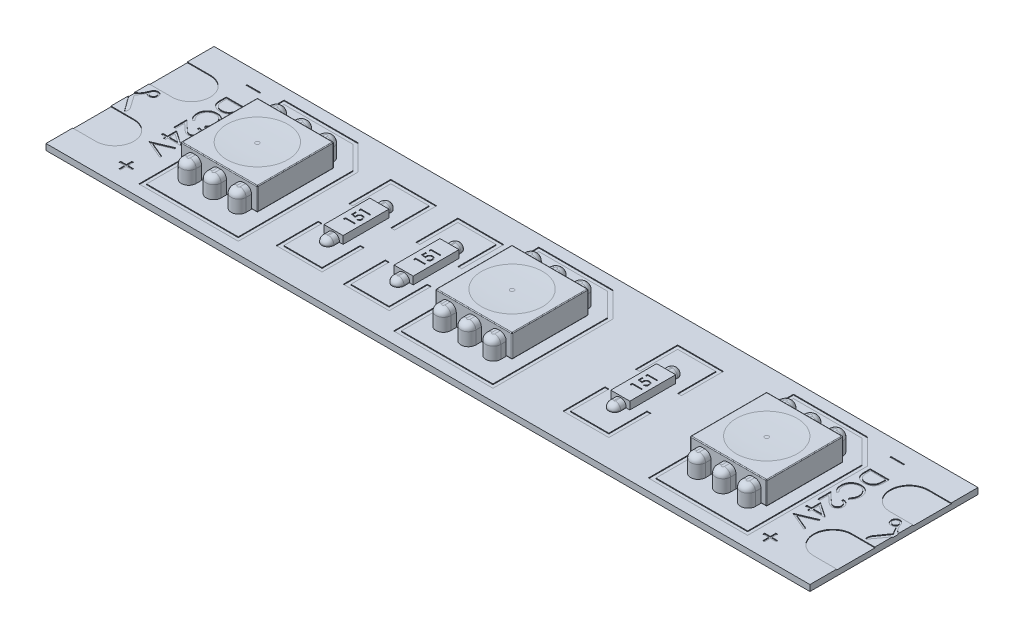
from build123d import *

# Parameters (mm, degrees)
SKETCH1_W               = 50
SKETCH1_H               = 11
BOSS_EXTRUDE1_DEPTH     = 0.4
CUT_EXTRUDE1_DEPTH      = 0.05
SKETCH3_W               = 5
SKETCH3_H               = 5
BOSS_EXTRUDE2_DEPTH     = 1.5
BOSS_EXTRUDE2_2_DEPTH   = 1.5
BOSS_EXTRUDE2_3_DEPTH   = 1.5
SKETCH4_R               = 2
CUT_EXTRUDE2_DEPTH      = 0.05
CUT_EXTRUDE_THIN1_DEPTH = 0.05
LPATTERN1_COUNT         = 3
LPATTERN1_PITCH         = 16.67
CUT_EXTRUDE_THIN2_START = -0.05
CUT_EXTRUDE_THIN2_DEPTH = 1.05
LPATTERN2_COUNT         = 2
LPATTERN2_PITCH         = 14.38
LPATTERN3_COUNT         = 2
LPATTERN3_PITCH         = 18.77
SKETCH8_W               = 1.25
SKETCH8_H               = 3
BOSS_EXTRUDE3_DEPTH     = 0.5
BOSS_EXTRUDE4_DEPTH     = 0.4
BOSS_EXTRUDE4_2_DEPTH   = 0.4
FILLET4_R               = 0.35
FILLET5_R               = 0.35
LPATTERN4_COUNT         = 2
LPATTERN4_PITCH         = 18.77
LPATTERN5_COUNT         = 2
LPATTERN5_PITCH         = 4.59
FILLET6_R               = 0.05
FILLET7_R               = 0.05
FILLET8_R               = 0.05
SKETCH10_W              = 0.897435897
SKETCH10_H              = 0.080128205
CUT_EXTRUDE3_DEPTH      = 0.05
LPATTERN6_COUNT         = 2
LPATTERN6_PITCH         = 42.15
CUT_EXTRUDE4_DEPTH      = 0.05
LPATTERN7_COUNT         = 2
LPATTERN7_PITCH         = 4.59
LPATTERN8_COUNT         = 2
LPATTERN8_PITCH         = 18.77
BOSS_EXTRUDE5_DEPTH     = 1.25
BOSS_EXTRUDE5_2_DEPTH   = 1.25
BOSS_EXTRUDE5_3_DEPTH   = 1.25
BOSS_EXTRUDE5_4_DEPTH   = 1.25
BOSS_EXTRUDE5_5_DEPTH   = 1.25
BOSS_EXTRUDE5_6_DEPTH   = 1.25
FILLET9_R               = 0.4
FILLET10_R              = 0.4
FILLET11_R              = 0.4
FILLET12_R              = 0.4
FILLET13_R              = 0.4
FILLET14_R              = 0.4
LPATTERN9_COUNT         = 3
LPATTERN9_PITCH         = 16.67
FILLET18_R              = 35
FILLET19_R              = 35
FILLET20_R              = 35
CUT_EXTRUDE5_DEPTH      = 0.05


with BuildPart() as part:
    # Sketch1 → Boss-Extrude1 (new body)
    with BuildSketch(Plane(origin=(0, 0, 0), x_dir=(1, 0, 0), z_dir=(0, 1, 0))):
        Rectangle(SKETCH1_W, SKETCH1_H)
    extrude(amount=BOSS_EXTRUDE1_DEPTH)

    # Sketch2 → Cut-Extrude1 (cut)
    with BuildSketch(Plane(origin=(0, 0.4, 0), x_dir=(1, 0, 0), z_dir=(0, 1, 0))):
        with BuildLine():
            Line((-26.5, 3.75), (-23.5, 3.75))
            ThreePointArc((-23.5, 3.75), (-22.25, 2.5), (-23.5, 1.25))
            Line((-23.5, 1.25), (-26.5, 1.25))
            ThreePointArc((-26.5, 1.25), (-27.75, 2.5), (-26.5, 3.75))
        make_face()
        with BuildLine():
            Line((-26.5, -3.75), (-23.5, -3.75))
            ThreePointArc((-23.5, -3.75), (-22.25, -2.5), (-23.5, -1.25))
            Line((-23.5, -1.25), (-26.5, -1.25))
            ThreePointArc((-26.5, -1.25), (-27.75, -2.5), (-26.5, -3.75))
        make_face()
        with BuildLine():
            Line((26.5, -3.75), (23.5, -3.75))
            ThreePointArc((23.5, -3.75), (22.25, -2.5), (23.5, -1.25))
            Line((23.5, -1.25), (26.5, -1.25))
            ThreePointArc((26.5, -1.25), (27.75, -2.5), (26.5, -3.75))
        make_face()
        with BuildLine():
            Line((26.5, 3.75), (23.5, 3.75))
            ThreePointArc((23.5, 3.75), (22.25, 2.5), (23.5, 1.25))
            Line((23.5, 1.25), (26.5, 1.25))
            ThreePointArc((26.5, 1.25), (27.75, 2.5), (26.5, 3.75))
        make_face()
    extrude(amount=-CUT_EXTRUDE1_DEPTH, mode=Mode.SUBTRACT)

    # Sketch5 → Cut-Extrude-Thin1 (cut)
    with BuildSketch(Plane(origin=(0, 0.4, 0), x_dir=(1, 0, 0), z_dir=(0, 1, 0))):
        Polygon((-13.166666667, 3.103553391), (-13.166666667, -4.75), (-19.666666667, -4.75), (-19.666666667, 4.75), (-14.813113276, 4.75), align=None)
        Polygon((-13.416666667, 3), (-13.416666667, -4.5), (-19.416666667, -4.5), (-19.416666667, 4.5), (-14.916666667, 4.5), align=None, mode=Mode.SUBTRACT)
    cut_extrude_thin1 = extrude(amount=-CUT_EXTRUDE_THIN1_DEPTH, mode=Mode.SUBTRACT)

    # LPattern1: Cut-Extrude-Thin1 ×3
    with Locations(*[(i * LPATTERN1_PITCH, 0, 0) for i in range(1, LPATTERN1_COUNT)]):
        add(cut_extrude_thin1, mode=Mode.SUBTRACT)

    # Cut-Extrude-Thin2: read off the stored shape, not the designer's step
    # Cut-Extrude-Thin2 outline → Cut-Extrude-Thin2 (cut)
    with BuildSketch(Plane(origin=(0, 0.4, 0), x_dir=(1, 0, 0), z_dir=(0, 1, 0)).offset(CUT_EXTRUDE_THIN2_START)):
        Polygon((10.088333333, 3.75), (7.088333333, 3.75), (7.088333333, 1), (7.338333333, 1), (7.338333333, 3.5), (9.838333333, 3.5), (9.838333333, 1), (10.088333333, 1), align=None)
        Polygon((7.088333333, -3.75), (10.088333333, -3.75), (10.088333333, -1), (9.838333333, -1), (9.838333333, -3.5), (7.338333333, -3.5), (7.338333333, -1), (7.088333333, -1), align=None)
    cut_extrude_thin2 = extrude(amount=CUT_EXTRUDE_THIN2_DEPTH, mode=Mode.SUBTRACT)

    # LPattern2: Cut-Extrude-Thin2 ×2
    with Locations(*[(-i * LPATTERN2_PITCH, 0, 0) for i in range(1, LPATTERN2_COUNT)]):
        add(cut_extrude_thin2, mode=Mode.SUBTRACT)

    # LPattern3: Cut-Extrude-Thin2 ×2
    with Locations(*[(-i * LPATTERN3_PITCH, 0, 0) for i in range(1, LPATTERN3_COUNT)]):
        add(cut_extrude_thin2, mode=Mode.SUBTRACT)

    # Sketch10 → Cut-Extrude3 (cut)
    # profile 1 of 7: a face of its own
    with BuildSketch(Plane(origin=(0, 0.4, 0), x_dir=(1, 0, 0), z_dir=(0, 1, 0))):
        with Locations((-21.303407586, 4.370192307)):
            Rectangle(SKETCH10_W, SKETCH10_H)
    # profile 2 of 7: a face of its own
    with BuildSketch(Plane(origin=(0, 0.4, 0), x_dir=(1, 0, 0), z_dir=(0, 1, 0))):
        with BuildLine():
            Line((-21.736099893, 3.032051282), (-20.486099893, 3.032051282))
            Line((-20.486099893, 3.032051282), (-20.486099893, 2.779647436))
            add(Edge.make_bspline(
                [(-20.486099893, 2.779647436), (-20.486257523, 2.75769418), (-20.486562063, 2.715280604), (-20.488504044, 2.653991056), (-20.491904722, 2.597363452), (-20.496953762, 2.54542995), (-20.503014025, 2.498107115), (-20.510721167, 2.455470741), (-20.519785287, 2.417451731), (-20.527516169, 2.394069834), (-20.531172008, 2.383012821)],
                knots=[0, 0, 0, 0, 1.314317071, 2.539253741, 3.67075822, 4.709970291, 5.662644612, 6.526156501, 7.303037452, 8, 8, 8, 8], degree=3))
            add(Edge.make_bspline(
                [(-20.531172008, 2.383012821), (-20.536682981, 2.368550423), (-20.547579955, 2.339953587), (-20.568135687, 2.299236624), (-20.591426415, 2.260906633), (-20.617480848, 2.22475511), (-20.647044145, 2.191618781), (-20.678832934, 2.160161717), (-20.714146193, 2.131796052), (-20.751784931, 2.105383456), (-20.792130975, 2.082272002), (-20.834365486, 2.061890384), (-20.878409438, 2.044488041), (-20.924583405, 2.03090942), (-20.97244412, 2.019691167), (-21.022353889, 2.012163987), (-21.074021749, 2.007163985), (-21.109084509, 2.006663964), (-21.126875133, 2.006410256)],
                knots=[0, 0, 0, 0, 0.98467389, 1.947018643, 2.898343565, 3.837828625, 4.779009928, 5.722093987, 6.681368302, 7.658573986, 8.646467994, 9.637429229, 10.641859304, 11.657149908, 12.698561448, 13.768651538, 14.867827761, 16, 16, 16, 16], degree=3))
            add(Edge.make_bspline(
                [(-21.126875133, 2.006410256), (-21.142325523, 2.006635039), (-21.172772131, 2.007077997), (-21.217644627, 2.011050586), (-21.261182455, 2.01683576), (-21.303194402, 2.025751403), (-21.343963479, 2.036706578), (-21.383296079, 2.050228642), (-21.421221032, 2.066253597), (-21.457429412, 2.084845764), (-21.49186132, 2.105175472), (-21.523924244, 2.127465808), (-21.554227977, 2.150437677), (-21.581405663, 2.175862357), (-21.607011684, 2.201987804), (-21.6296625, 2.230199402), (-21.650344762, 2.259578032), (-21.668907506, 2.290689574), (-21.685012742, 2.324279724), (-21.698809812, 2.360806942), (-21.710170314, 2.400466858), (-21.719663804, 2.443198683), (-21.727190272, 2.489086147), (-21.732235746, 2.538171344), (-21.735647412, 2.590379704), (-21.735946137, 2.626229435), (-21.736099893, 2.64468149)],
                knots=[0, 0, 0, 0, 1.105818345, 2.179130549, 3.222742436, 4.24813173, 5.251184997, 6.243232575, 7.223185975, 8.195898781, 9.155064964, 10.083206407, 10.990357329, 11.874224667, 12.744762365, 13.607037788, 14.46074101, 15.315384698, 16.197310979, 17.123950979, 18.107232398, 19.148086642, 20.256146639, 21.433991621, 22.679261309, 24, 24, 24, 24], degree=3))
            Line((-21.736099893, 2.64468149), (-21.736099893, 3.032051282))
        make_face()
        with BuildLine():
            Line((-21.607894765, 2.919871795), (-21.607894765, 2.776392228))
            add(Edge.make_bspline(
                [(-21.607894765, 2.776392228), (-21.607806159, 2.755774952), (-21.607635737, 2.716120381), (-21.606140308, 2.659099668), (-21.603696759, 2.606999884), (-21.600277088, 2.55981363), (-21.595752583, 2.51756755), (-21.590707974, 2.480173354), (-21.584423171, 2.447753619), (-21.578726399, 2.428135963), (-21.576093883, 2.419070513)],
                knots=[0, 0, 0, 0, 1.375205317, 2.645023457, 3.804390687, 4.853969522, 5.800190428, 6.637939096, 7.370582563, 8, 8, 8, 8], degree=3))
            add(Edge.make_bspline(
                [(-21.576093883, 2.419070513), (-21.572075769, 2.407660142), (-21.564135513, 2.385111938), (-21.549646304, 2.352657896), (-21.532504399, 2.322374665), (-21.513337546, 2.293757016), (-21.491848906, 2.266990259), (-21.467973439, 2.242193136), (-21.441975189, 2.219189406), (-21.413756764, 2.198230706), (-21.383500604, 2.179503004), (-21.351591895, 2.163179737), (-21.318107648, 2.149329685), (-21.282927177, 2.138067592), (-21.246083643, 2.129340118), (-21.207673975, 2.123130622), (-21.16768619, 2.119270374), (-21.140489127, 2.118819558), (-21.126624733, 2.118589744)],
                knots=[0, 0, 0, 0, 0.998463025, 1.973077781, 2.929496817, 3.867873318, 4.813809365, 5.759268434, 6.706333209, 7.676553387, 8.657505312, 9.640584699, 10.632319813, 11.645628493, 12.686877747, 13.755137172, 14.855624085, 16, 16, 16, 16], degree=3))
            add(Edge.make_bspline(
                [(-21.126624733, 2.118589744), (-21.11200572, 2.118773256), (-21.083286541, 2.119133767), (-21.041145766, 2.123657537), (-21.000621458, 2.130282414), (-20.961684442, 2.139811784), (-20.924385375, 2.152122907), (-20.888513534, 2.166854165), (-20.854530556, 2.184740223), (-20.822148616, 2.204989133), (-20.79185812, 2.227722242), (-20.764013936, 2.252838708), (-20.738564198, 2.280073693), (-20.715468385, 2.309301679), (-20.695137225, 2.340931322), (-20.677050942, 2.374427388), (-20.661683761, 2.410261713), (-20.653513338, 2.435195288), (-20.649361111, 2.447866587)],
                knots=[0, 0, 0, 0, 1.122272916, 2.204715076, 3.251197285, 4.274229216, 5.279697671, 6.265416158, 7.248880903, 8.225321784, 9.195852973, 10.153576302, 11.101466393, 12.055578741, 13.010401466, 13.985536859, 14.976245305, 16, 16, 16, 16], degree=3))
            add(Edge.make_bspline(
                [(-20.649361111, 2.447866587), (-20.646462387, 2.458349139), (-20.640298904, 2.480637921), (-20.633575556, 2.517009158), (-20.627645378, 2.55794314), (-20.62262465, 2.603621605), (-20.619022035, 2.653992483), (-20.616317994, 2.709094515), (-20.614494197, 2.768951516), (-20.614369658, 2.810445278), (-20.614305021, 2.83198117)],
                knots=[0, 0, 0, 0, 0.674548936, 1.434276114, 2.292660221, 3.240891867, 4.284742987, 5.42552168, 6.663806718, 8, 8, 8, 8], degree=3))
            Line((-20.614305021, 2.83198117), (-20.614305021, 2.919871795))
            Line((-20.614305021, 2.919871795), (-21.607894765, 2.919871795))
        make_face(mode=Mode.SUBTRACT)
    # profile 3 of 7: a face of its own
    with BuildSketch(Plane(origin=(0, 0.4, 0), x_dir=(1, 0, 0), z_dir=(0, 1, 0))):
        with BuildLine():
            Line((-20.71546688, 0.596153846), (-20.790587072, 0.694310897))
            add(Edge.make_bspline(
                [(-20.790587072, 0.694310897), (-20.782242083, 0.701313), (-20.765664613, 0.715222803), (-20.742386205, 0.737601089), (-20.720577183, 0.760923105), (-20.700133654, 0.785179934), (-20.681770524, 0.810808191), (-20.664530844, 0.837187047), (-20.64907808, 0.864757778), (-20.6303413, 0.902883397), (-20.610789101, 0.952757629), (-20.59439509, 1.0155415), (-20.583958956, 1.081081178), (-20.582828656, 1.125794606), (-20.582253739, 1.14853766)],
                knots=[0, 0, 0, 0, 0.757959112, 1.505699292, 2.245454638, 2.979532153, 3.711538275, 4.438200793, 5.171680507, 5.909471876, 7.393775596, 8.890124382, 10.418191784, 12, 12, 12, 12], degree=3))
            add(Edge.make_bspline(
                [(-20.582253739, 1.14853766), (-20.582398662, 1.161067258), (-20.582687164, 1.186010166), (-20.58646653, 1.223029726), (-20.59183965, 1.25942813), (-20.599618357, 1.295070027), (-20.609745528, 1.329884648), (-20.621621996, 1.364137076), (-20.636401055, 1.397423911), (-20.652722553, 1.43014575), (-20.671162846, 1.46149402), (-20.691270083, 1.491161155), (-20.712846915, 1.519011619), (-20.735837645, 1.545122585), (-20.760528002, 1.569207692), (-20.786627533, 1.591652938), (-20.814450378, 1.612053808), (-20.843474744, 1.630911617), (-20.87374329, 1.647691694), (-20.905065602, 1.662182103), (-20.937321923, 1.674601589), (-20.970578333, 1.684519929), (-21.00470396, 1.692343143), (-21.039771226, 1.697747774), (-21.075712063, 1.701493142), (-21.1000725, 1.701778989), (-21.112351896, 1.701923077)],
                knots=[0, 0, 0, 0, 1.055000685, 2.100209969, 3.131349012, 4.153242145, 5.170189196, 6.184191144, 7.204341339, 8.235672124, 9.263040994, 10.265373269, 11.252624173, 12.22887325, 13.193405896, 14.155809299, 15.126090485, 16.097288279, 17.069732292, 18.038585918, 19.002221264, 19.978698174, 20.959418239, 21.948869816, 22.966084182, 24, 24, 24, 24], degree=3))
            add(Edge.make_bspline(
                [(-21.112351896, 1.701923077), (-21.130827368, 1.701472427), (-21.167101505, 1.700587636), (-21.220233866, 1.692713231), (-21.271134107, 1.680747127), (-21.31948405, 1.662812993), (-21.365879892, 1.640699046), (-21.409536626, 1.612755971), (-21.45111397, 1.580392922), (-21.489629309, 1.543152057), (-21.524812782, 1.502292837), (-21.555795133, 1.458454298), (-21.581621876, 1.411745623), (-21.603113286, 1.362682541), (-21.619633546, 1.310887501), (-21.63126359, 1.256453642), (-21.638850083, 1.199499358), (-21.6395764, 1.160581716), (-21.639946047, 1.14077524)],
                knots=[0, 0, 0, 0, 1.029171465, 2.020641659, 2.987623507, 3.938342917, 4.889210282, 5.84687017, 6.821220943, 7.821438502, 8.827599549, 9.822697543, 10.807740252, 11.797342354, 12.80366471, 13.83203677, 14.896651826, 16, 16, 16, 16], degree=3))
            add(Edge.make_bspline(
                [(-21.639946047, 1.14077524), (-21.639342911, 1.118952851), (-21.638155796, 1.07600117), (-21.628098921, 1.013012589), (-21.611792522, 0.952714101), (-21.588971836, 0.895102463), (-21.559305661, 0.840340089), (-21.523342134, 0.788341282), (-21.480739158, 0.73906215), (-21.448209469, 0.709429549), (-21.431612713, 0.694310897)],
                knots=[0, 0, 0, 0, 1.028121516, 2.023589091, 2.998037872, 3.967518031, 4.937445131, 5.927275754, 6.942489185, 8, 8, 8, 8], degree=3))
            Line((-21.431612713, 0.694310897), (-21.505981704, 0.596153846))
            add(Edge.make_bspline(
                [(-21.505981704, 0.596153846), (-21.516174026, 0.604053161), (-21.536509848, 0.619813952), (-21.565178058, 0.645334828), (-21.59214475, 0.672218996), (-21.617186737, 0.700669626), (-21.640826798, 0.730346447), (-21.662272417, 0.761772202), (-21.682176863, 0.794404107), (-21.700161304, 0.82843215), (-21.716286329, 0.863744612), (-21.729899521, 0.900304744), (-21.741794911, 0.937802807), (-21.751516418, 0.976257686), (-21.759116317, 1.015797846), (-21.764193926, 1.056287625), (-21.76767341, 1.097812493), (-21.767990491, 1.125827299), (-21.768151175, 1.140024038)],
                knots=[0, 0, 0, 0, 0.986756325, 1.968786143, 2.935506311, 3.899499537, 4.868307269, 5.8376204, 6.809456583, 7.792545619, 8.781780509, 9.778496008, 10.776623214, 11.79151764, 12.812666265, 13.856269958, 14.913646641, 16, 16, 16, 16], degree=3))
            add(Edge.make_bspline(
                [(-21.768151175, 1.140024038), (-21.768057606, 1.153468205), (-21.767872586, 1.18005238), (-21.764875383, 1.219301934), (-21.760786191, 1.257512499), (-21.754629002, 1.294574865), (-21.747363166, 1.330691285), (-21.737623431, 1.365534351), (-21.726713015, 1.399446926), (-21.713889805, 1.432292762), (-21.69941974, 1.464099798), (-21.683065612, 1.494765445), (-21.664964946, 1.524275599), (-21.645516728, 1.552920392), (-21.624096263, 1.580276672), (-21.601001036, 1.606581503), (-21.57630889, 1.631982387), (-21.558503585, 1.647697632), (-21.549551415, 1.655598958)],
                knots=[0, 0, 0, 0, 1.114604814, 2.203992996, 3.262667896, 4.300477797, 5.318619304, 6.316056647, 7.298880507, 8.271930387, 9.238335007, 10.195173496, 11.151986948, 12.108099108, 13.064862484, 14.031167946, 15.010108607, 16, 16, 16, 16], degree=3))
            add(Edge.make_bspline(
                [(-21.549551415, 1.655598958), (-21.534000991, 1.668254545), (-21.50308788, 1.69341293), (-21.452985744, 1.725600674), (-21.400675669, 1.753153372), (-21.345882837, 1.775430487), (-21.288730199, 1.792845749), (-21.229188944, 1.804910461), (-21.167314679, 1.81275032), (-21.125230112, 1.813646852), (-21.103838274, 1.814102564)],
                knots=[0, 0, 0, 0, 0.994628077, 1.977248131, 2.950237994, 3.925870899, 4.908910175, 5.911660606, 6.938484602, 8, 8, 8, 8], degree=3))
            add(Edge.make_bspline(
                [(-21.103838274, 1.814102564), (-21.081355125, 1.813544654), (-21.037120931, 1.812446999), (-20.972188236, 1.803198244), (-20.91006764, 1.788139483), (-20.850520119, 1.76740347), (-20.793886381, 1.740047123), (-20.739927237, 1.706930054), (-20.688686747, 1.667728787), (-20.640820025, 1.622935654), (-20.597057136, 1.573801874), (-20.558554616, 1.521188689), (-20.526512726, 1.465194958), (-20.499728361, 1.40643863), (-20.479141058, 1.344479445), (-20.464729204, 1.279449674), (-20.455758806, 1.211471489), (-20.454624803, 1.165092052), (-20.454048611, 1.141526442)],
                knots=[0, 0, 0, 0, 1.032901378, 2.032168977, 3.007206631, 3.966850309, 4.924221947, 5.891988639, 6.871730993, 7.884084801, 8.900290346, 9.89161143, 10.874607481, 11.860025555, 12.854717796, 13.869097222, 14.917278314, 16, 16, 16, 16], degree=3))
            add(Edge.make_bspline(
                [(-20.454048611, 1.141526442), (-20.454220674, 1.127164103), (-20.454561257, 1.098735298), (-20.457886744, 1.056681187), (-20.463420461, 1.015735999), (-20.471002026, 0.975800714), (-20.480294484, 0.936730518), (-20.492459029, 0.898926242), (-20.506585048, 0.862182028), (-20.522439479, 0.826470357), (-20.540564725, 0.792179759), (-20.560250643, 0.759316477), (-20.581951649, 0.728276945), (-20.604950307, 0.698477307), (-20.630106918, 0.670588449), (-20.656602237, 0.64381387), (-20.685222473, 0.619078466), (-20.705366956, 0.603809374), (-20.71546688, 0.596153846)],
                knots=[0, 0, 0, 0, 1.096705196, 2.170817488, 3.219277236, 4.250701065, 5.274195539, 6.284202015, 7.28098643, 8.279664616, 9.266225751, 10.241373748, 11.203306326, 12.157093976, 13.114198862, 14.069774147, 15.032234603, 16, 16, 16, 16], degree=3))
        make_face()
    # profile 4 of 7: a face of its own
    with BuildSketch(Plane(origin=(0, 0.4, 0), x_dir=(1, 0, 0), z_dir=(0, 1, 0))):
        with BuildLine():
            Line((-20.870715278, 0.291666667), (-20.870715278, 0.403846154))
            add(Edge.make_bspline(
                [(-20.870715278, 0.403846154), (-20.855832744, 0.403115152), (-20.826603845, 0.401679484), (-20.783989202, 0.394953335), (-20.743251589, 0.385337966), (-20.704740254, 0.371710745), (-20.667995149, 0.354882319), (-20.633504206, 0.334279454), (-20.600925105, 0.310341372), (-20.570874678, 0.283111988), (-20.543404831, 0.253565596), (-20.519432183, 0.221879226), (-20.499409379, 0.188378553), (-20.48257975, 0.153354149), (-20.469962409, 0.116400945), (-20.460596437, 0.077872173), (-20.454962328, 0.037593686), (-20.454356649, 0.010150852), (-20.454048611, -0.00380609)],
                knots=[0, 0, 0, 0, 1.100776268, 2.161895295, 3.184016182, 4.190939212, 5.176500551, 6.166955529, 7.155448256, 8.160289653, 9.16017456, 10.133824356, 11.091467644, 12.04088621, 13.000931625, 13.972173743, 14.968683325, 16, 16, 16, 16], degree=3))
            add(Edge.make_bspline(
                [(-20.454048611, -0.00380609), (-20.454369488, -0.017512545), (-20.455000001, -0.044445239), (-20.460414654, -0.083753102), (-20.468895222, -0.121173564), (-20.480793585, -0.156633481), (-20.496788024, -0.189849932), (-20.51600143, -0.221072448), (-20.538222799, -0.250672738), (-20.564384875, -0.277318017), (-20.592314298, -0.301785189), (-20.622131406, -0.322893137), (-20.65292758, -0.340969267), (-20.684937652, -0.356036295), (-20.718463019, -0.367127773), (-20.753015592, -0.375548562), (-20.788953024, -0.380308353), (-20.813276794, -0.381038861), (-20.825643162, -0.381410256)],
                knots=[0, 0, 0, 0, 1.111607364, 2.184268762, 3.212621178, 4.221274766, 5.211760367, 6.196651075, 7.1921475, 8.207485113, 9.220403448, 10.201281604, 11.166441695, 12.114753415, 13.065576456, 14.026450734, 14.996634279, 16, 16, 16, 16], degree=3))
            add(Edge.make_bspline(
                [(-20.825643162, -0.381410256), (-20.843053103, -0.38080552), (-20.877567465, -0.379606658), (-20.928287059, -0.369351524), (-20.977427566, -0.353334913), (-21.016976602, -0.334050143), (-21.048845707, -0.314595698), (-21.07508453, -0.297064446), (-21.103336483, -0.276541299), (-21.133506961, -0.252727549), (-21.165832284, -0.226115809), (-21.200292925, -0.196465037), (-21.236532843, -0.163563793), (-21.261284844, -0.140471472), (-21.27411071, -0.128505609)],
                knots=[0, 0, 0, 0, 1.184426356, 2.348067706, 3.509069118, 4.696110526, 5.333549288, 6.050745305, 6.844228056, 7.710549037, 8.667450064, 9.695053472, 10.805634456, 12, 12, 12, 12], degree=3))
            Line((-21.27411071, -0.128505609), (-21.607894765, 0.184244792))
            Line((-21.607894765, 0.184244792), (-21.607894765, -0.397435897))
            Line((-21.607894765, -0.397435897), (-21.736099893, -0.397435897))
            Line((-21.736099893, -0.397435897), (-21.736099893, 0.451923077))
            Line((-21.736099893, 0.451923077), (-21.218772169, -0.032852564))
            add(Edge.make_bspline(
                [(-21.218772169, -0.032852564), (-21.206452017, -0.044656216), (-21.182787527, -0.067328617), (-21.148227628, -0.099382829), (-21.11620358, -0.128218975), (-21.086573475, -0.153856184), (-21.059505289, -0.17631555), (-21.034786894, -0.195525212), (-21.012630417, -0.211570075), (-20.986601915, -0.228574286), (-20.95478494, -0.244788929), (-20.916098513, -0.259039942), (-20.876185801, -0.267667311), (-20.84922214, -0.26870753), (-20.835659188, -0.269230769)],
                knots=[0, 0, 0, 0, 1.329530082, 2.553755191, 3.672934919, 4.687409497, 5.60679272, 6.413407421, 7.126401618, 7.737995624, 8.834647426, 9.90044882, 10.943907757, 12, 12, 12, 12], degree=3))
            add(Edge.make_bspline(
                [(-20.835659188, -0.269230769), (-20.827129174, -0.269006051), (-20.810318156, -0.268563174), (-20.785686765, -0.264580532), (-20.76183479, -0.258729241), (-20.739057143, -0.249710595), (-20.716905832, -0.238875023), (-20.696054325, -0.225031781), (-20.675791845, -0.209212591), (-20.656813176, -0.190863106), (-20.639425768, -0.170718781), (-20.624024639, -0.14943443), (-20.611153442, -0.126916716), (-20.600602216, -0.103259481), (-20.592325288, -0.078528969), (-20.586590083, -0.052677271), (-20.582989195, -0.025775838), (-20.582501991, -0.007406732), (-20.582253739, 0.001953125)],
                knots=[0, 0, 0, 0, 0.991504627, 1.954065223, 2.895985987, 3.842598665, 4.797835564, 5.759220273, 6.74786863, 7.784730864, 8.824135544, 9.839918996, 10.835834653, 11.835434876, 12.84861661, 13.863796685, 14.911511676, 16, 16, 16, 16], degree=3))
            add(Edge.make_bspline(
                [(-20.582253739, 0.001953125), (-20.582509031, 0.011728466), (-20.583010381, 0.030925621), (-20.586519571, 0.059110374), (-20.592567668, 0.086000393), (-20.600859482, 0.111650109), (-20.611298941, 0.136084236), (-20.62455262, 0.159081842), (-20.640103047, 0.180852886), (-20.657829685, 0.201357382), (-20.67765903, 0.220197797), (-20.699491447, 0.237099181), (-20.723468952, 0.251514274), (-20.749049967, 0.264292606), (-20.776914658, 0.27406992), (-20.806387801, 0.282427475), (-20.837888137, 0.28849862), (-20.859591156, 0.290593112), (-20.870715278, 0.291666667)],
                knots=[0, 0, 0, 0, 1.031212865, 2.025131798, 2.990757446, 3.934781266, 4.865570067, 5.788494791, 6.729227313, 7.684356718, 8.643577152, 9.610526866, 10.590658432, 11.59095419, 12.621640561, 13.700587263, 14.82141059, 16, 16, 16, 16], degree=3))
        make_face()
    # profile 5 of 7: a face of its own
    with BuildSketch(Plane(origin=(0, 0.4, 0), x_dir=(1, 0, 0), z_dir=(0, 1, 0))):
        Polygon((-20.454048611, -1.191957131), (-20.454048611, -1.21474359), (-21.319433226, -1.21474359), (-21.319433226, -1.358974359), (-21.447638355, -1.358974359), (-21.447638355, -1.21474359), (-21.736099893, -1.21474359), (-21.736099893, -1.102564103), (-21.447638355, -1.102564103), (-21.447638355, -0.509615385), align=None)
        Polygon((-21.319433226, -1.102564103), (-20.776564637, -1.102564103), (-21.319433226, -0.729967949), align=None, mode=Mode.SUBTRACT)
    # profile 6 of 7: a face of its own
    with BuildSketch(Plane(origin=(0, 0.4, 0), x_dir=(1, 0, 0), z_dir=(0, 1, 0))):
        Polygon((-20.486099893, -1.487179487), (-20.486099893, -1.607371795), (-21.471176015, -2.024038462), (-20.486099893, -2.440705128), (-20.486099893, -2.560897436), (-21.736099893, -2.032051282), (-21.736099893, -2.016025641), align=None)
    # profile 7 of 7: a face of its own
    with BuildSketch(Plane(origin=(0, 0.4, 0), x_dir=(1, 0, 0), z_dir=(0, 1, 0))):
        Polygon((-21.06302297, -4.067307692), (-20.694433226, -4.067307692), (-20.694433226, -4.179487179), (-21.06302297, -4.179487179), (-21.06302297, -4.548076923), (-21.175202457, -4.548076923), (-21.175202457, -4.179487179), (-21.543792201, -4.179487179), (-21.543792201, -4.067307692), (-21.175202457, -4.067307692), (-21.175202457, -3.698717949), (-21.06302297, -3.698717949), align=None)
    cut_extrude3 = extrude(amount=-CUT_EXTRUDE3_DEPTH, mode=Mode.SUBTRACT)

    # LPattern6: Cut-Extrude3 ×2
    with Locations(*[(i * LPATTERN6_PITCH, 0, 0) for i in range(1, LPATTERN6_COUNT)]):
        add(cut_extrude3, mode=Mode.SUBTRACT)

    # Sketch14 → Cut-Extrude5 (cut)
    # profile 1 of 2: a face of its own
    with BuildSketch(Plane(origin=(0, 0.4, 0), x_dir=(1, 0, 0), z_dir=(0, 1, 0))):
        with BuildLine():
            Line((-25.153037, 0.113892595), (-25.725001, -0.693609405))
            add(Edge.make_bspline(
                [(-25.725001, -0.693609405), (-25.796599, -0.810489405), (-25.839587, -0.965981405), (-25.746759, -1.114005405)],
                knots=[0.25, 0.25, 0.25, 0.25, 0.5, 0.5, 0.5, 0.5], degree=3))
            Line((-25.746759, -1.114005405), (-24.999009, -0.096671405))
            Line((-24.999009, -0.096671405), (-24.247501, -1.124021405))
            add(Edge.make_bspline(
                [(-24.268323, -0.703575405), (-24.196985, -0.820617405), (-24.154341, -0.976203405), (-24.247501, -1.124021405)],
                knots=[0.25, 0.25, 0.25, 0.25, 0.5, 0.5, 0.5, 0.5], degree=3))
            Line((-24.268323, -0.703575405), (-24.844459, 0.113672595))
            add(Edge.make_bspline(
                [(-24.844459, 0.113672595), (-24.632181, 0.406328595), (-24.574057, 0.636966595), (-24.502161, 0.616496595)],
                knots=[0, 0, 0, 0, 0.125, 0.125, 0.125, 0.125], degree=3))
            add(Edge.make_bspline(
                [(-24.502161, 0.616496595), (-24.445963, 0.600496595), (-24.472971, 0.552398595), (-24.324453, 0.518464595)],
                knots=[0.125, 0.125, 0.125, 0.125, 0.25, 0.25, 0.25, 0.25], degree=3))
            add(Edge.make_bspline(
                [(-24.324453, 0.518464595), (-24.181853, 0.485882595), (-24.036159, 0.602954595), (-24.005889, 0.744204595)],
                knots=[0.25, 0.25, 0.25, 0.25, 0.375, 0.375, 0.375, 0.375], degree=3))
            add(Edge.make_bspline(
                [(-24.005889, 0.744204595), (-23.965573, 0.882648595), (-24.030921, 1.056660595), (-24.177119, 1.099618595)],
                knots=[0.375, 0.375, 0.375, 0.375, 0.5, 0.5, 0.5, 0.5], degree=3))
            add(Edge.make_bspline(
                [(-24.177119, 1.099618595), (-24.321797, 1.151978595), (-24.494245, 1.066870595), (-24.545723, 0.922774595)],
                knots=[0.5, 0.5, 0.5, 0.5, 0.625, 0.625, 0.625, 0.625], degree=3))
            add(Edge.make_bspline(
                [(-24.545723, 0.922774595), (-24.620313, 0.758042595), (-24.658563, 0.540480595), (-24.899631, 0.353746595)],
                knots=[0.625, 0.625, 0.625, 0.625, 0.75, 0.75, 0.75, 0.75], degree=3))
            Line((-24.899631, 0.353746595), (-25.000991, 0.275296595))
            Line((-25.000991, 0.275296595), (-25.091357, 0.345616595))
            add(Edge.make_bspline(
                [(-25.443997, 0.915430595), (-25.369773, 0.750536595), (-25.332009, 0.532888595), (-25.091357, 0.345616595)],
                knots=[0.666666667, 0.666666667, 0.666666667, 0.666666667, 0.777777778, 0.777777778, 0.777777778, 0.777777778], degree=3))
            add(Edge.make_bspline(
                [(-25.812205, 1.093096595), (-25.667409, 1.145134595), (-25.495151, 1.059642595), (-25.443997, 0.915430595)],
                knots=[0.555555556, 0.555555556, 0.555555556, 0.555555556, 0.666666667, 0.666666667, 0.666666667, 0.666666667], degree=3))
            add(Edge.make_bspline(
                [(-25.984227, 0.738066595), (-26.024233, 0.876598595), (-25.958497, 1.050466595), (-25.812205, 1.093096595)],
                knots=[0.444444444, 0.444444444, 0.444444444, 0.444444444, 0.555555556, 0.555555556, 0.555555556, 0.555555556], degree=3))
            add(Edge.make_bspline(
                [(-25.666167, 0.511616595), (-25.808839, 0.479350595), (-25.954273, 0.596748595), (-25.984227, 0.738066595)],
                knots=[0.333333333, 0.333333333, 0.333333333, 0.333333333, 0.444444444, 0.444444444, 0.444444444, 0.444444444], degree=3))
            add(Edge.make_bspline(
                [(-25.488239, 0.609252595), (-25.544473, 0.593376595), (-25.517571, 0.545220595), (-25.666167, 0.511616595)],
                knots=[0.222222222, 0.222222222, 0.222222222, 0.222222222, 0.333333333, 0.333333333, 0.333333333, 0.333333333], degree=3))
            add(Edge.make_bspline(
                [(-25.159287, 0.122436595), (-25.370915, 0.415566595), (-25.416299, 0.629562595), (-25.488239, 0.609252595)],
                knots=[0.111111111, 0.111111111, 0.111111111, 0.111111111, 0.222222222, 0.222222222, 0.222222222, 0.222222222], degree=3))
            Line((-25.159287, 0.122436595), (-25.153037, 0.113892595))
        make_face()
        with BuildLine():
            add(Edge.make_bspline(
                [(-24.145233, 0.676072595), (-24.268559, 0.553042595), (-24.486723, 0.628072595), (-24.486351, 0.792302595)],
                knots=[0, 0, 0, 0, 0.25, 0.25, 0.25, 0.25], degree=3))
            add(Edge.make_bspline(
                [(-24.486351, 0.792302595), (-24.495083, 0.943398595), (-24.311435, 1.081008595), (-24.174925, 0.994760595)],
                knots=[0.25, 0.25, 0.25, 0.25, 0.5, 0.5, 0.5, 0.5], degree=3))
            add(Edge.make_bspline(
                [(-24.174925, 0.994760595), (-24.059985, 0.934288595), (-24.060809, 0.760294595), (-24.145233, 0.676072595)],
                knots=[0.5, 0.5, 0.5, 0.5, 1, 1, 1, 1], degree=3))
        make_face(mode=Mode.SUBTRACT)
        with BuildLine():
            add(Edge.make_bspline(
                [(-25.845033, 0.669622595), (-25.721981, 0.546318595), (-25.503651, 0.620862595), (-25.503659, 0.785092595)],
                knots=[0, 0, 0, 0, 0.25, 0.25, 0.25, 0.25], degree=3))
            add(Edge.make_bspline(
                [(-25.503659, 0.785092595), (-25.494587, 0.936168595), (-25.677929, 1.074188595), (-25.814631, 0.988244595)],
                knots=[0.25, 0.25, 0.25, 0.25, 0.5, 0.5, 0.5, 0.5], degree=3))
            add(Edge.make_bspline(
                [(-25.814631, 0.988244595), (-25.929705, 0.928028595), (-25.929269, 0.754032595), (-25.845033, 0.669622595)],
                knots=[0.5, 0.5, 0.5, 0.5, 1, 1, 1, 1], degree=3))
        make_face(mode=Mode.SUBTRACT)
    # profile 2 of 2: a face of its own
    with BuildSketch(Plane(origin=(0, 0.4, 0), x_dir=(1, 0, 0), z_dir=(0, 1, 0))):
        with BuildLine():
            Line((25.100369, 0.353746595), (24.999009, 0.275296595))
            Line((24.999009, 0.275296595), (24.908643, 0.345616595))
            add(Edge.make_bspline(
                [(24.556003, 0.915430595), (24.630227, 0.750536595), (24.667991, 0.532888595), (24.908643, 0.345616595)],
                knots=[0.666666667, 0.666666667, 0.666666667, 0.666666667, 0.777777778, 0.777777778, 0.777777778, 0.777777778], degree=3))
            add(Edge.make_bspline(
                [(24.187795, 1.093096595), (24.332591, 1.145134595), (24.504849, 1.059642595), (24.556003, 0.915430595)],
                knots=[0.555555556, 0.555555556, 0.555555556, 0.555555556, 0.666666667, 0.666666667, 0.666666667, 0.666666667], degree=3))
            add(Edge.make_bspline(
                [(24.015773, 0.738066595), (23.975767, 0.876598595), (24.041503, 1.050466595), (24.187795, 1.093096595)],
                knots=[0.444444444, 0.444444444, 0.444444444, 0.444444444, 0.555555556, 0.555555556, 0.555555556, 0.555555556], degree=3))
            add(Edge.make_bspline(
                [(24.333833, 0.511616595), (24.191161, 0.479350595), (24.045727, 0.596748595), (24.015773, 0.738066595)],
                knots=[0.333333333, 0.333333333, 0.333333333, 0.333333333, 0.444444444, 0.444444444, 0.444444444, 0.444444444], degree=3))
            add(Edge.make_bspline(
                [(24.511761, 0.609252595), (24.455527, 0.593376595), (24.482429, 0.545220595), (24.333833, 0.511616595)],
                knots=[0.222222222, 0.222222222, 0.222222222, 0.222222222, 0.333333333, 0.333333333, 0.333333333, 0.333333333], degree=3))
            add(Edge.make_bspline(
                [(24.840713, 0.122436595), (24.629085, 0.415566595), (24.583701, 0.629562595), (24.511761, 0.609252595)],
                knots=[0.111111111, 0.111111111, 0.111111111, 0.111111111, 0.222222222, 0.222222222, 0.222222222, 0.222222222], degree=3))
            Line((24.840713, 0.122436595), (24.846963, 0.113892595))
            Line((24.846963, 0.113892595), (24.274999, -0.693609405))
            add(Edge.make_bspline(
                [(24.274999, -0.693609405), (24.203401, -0.810489405), (24.160413, -0.965981405), (24.253241, -1.114005405)],
                knots=[0.25, 0.25, 0.25, 0.25, 0.5, 0.5, 0.5, 0.5], degree=3))
            Line((24.253241, -1.114005405), (25.000991, -0.096671405))
            Line((25.000991, -0.096671405), (25.752499, -1.124021405))
            add(Edge.make_bspline(
                [(25.731677, -0.703575405), (25.803015, -0.820617405), (25.845659, -0.976203405), (25.752499, -1.124021405)],
                knots=[0.25, 0.25, 0.25, 0.25, 0.5, 0.5, 0.5, 0.5], degree=3))
            Line((25.731677, -0.703575405), (25.155541, 0.113672595))
            add(Edge.make_bspline(
                [(25.155541, 0.113672595), (25.367819, 0.406328595), (25.425943, 0.636966595), (25.497839, 0.616496595)],
                knots=[0, 0, 0, 0, 0.125, 0.125, 0.125, 0.125], degree=3))
            add(Edge.make_bspline(
                [(25.497839, 0.616496595), (25.554037, 0.600496595), (25.527029, 0.552398595), (25.675547, 0.518464595)],
                knots=[0.125, 0.125, 0.125, 0.125, 0.25, 0.25, 0.25, 0.25], degree=3))
            add(Edge.make_bspline(
                [(25.675547, 0.518464595), (25.818147, 0.485882595), (25.963841, 0.602954595), (25.994111, 0.744204595)],
                knots=[0.25, 0.25, 0.25, 0.25, 0.375, 0.375, 0.375, 0.375], degree=3))
            add(Edge.make_bspline(
                [(25.994111, 0.744204595), (26.034427, 0.882648595), (25.969079, 1.056660595), (25.822881, 1.099618595)],
                knots=[0.375, 0.375, 0.375, 0.375, 0.5, 0.5, 0.5, 0.5], degree=3))
            add(Edge.make_bspline(
                [(25.822881, 1.099618595), (25.678203, 1.151978595), (25.505755, 1.066870595), (25.454277, 0.922774595)],
                knots=[0.5, 0.5, 0.5, 0.5, 0.625, 0.625, 0.625, 0.625], degree=3))
            add(Edge.make_bspline(
                [(25.454277, 0.922774595), (25.379687, 0.758042595), (25.341437, 0.540480595), (25.100369, 0.353746595)],
                knots=[0.625, 0.625, 0.625, 0.625, 0.75, 0.75, 0.75, 0.75], degree=3))
        make_face()
        with BuildLine():
            add(Edge.make_bspline(
                [(24.185369, 0.988244595), (24.070295, 0.928028595), (24.070731, 0.754032595), (24.154967, 0.669622595)],
                knots=[0.5, 0.5, 0.5, 0.5, 1, 1, 1, 1], degree=3))
            add(Edge.make_bspline(
                [(24.154967, 0.669622595), (24.278019, 0.546318595), (24.496349, 0.620862595), (24.496341, 0.785092595)],
                knots=[0, 0, 0, 0, 0.25, 0.25, 0.25, 0.25], degree=3))
            add(Edge.make_bspline(
                [(24.496341, 0.785092595), (24.505413, 0.936168595), (24.322071, 1.074188595), (24.185369, 0.988244595)],
                knots=[0.25, 0.25, 0.25, 0.25, 0.5, 0.5, 0.5, 0.5], degree=3))
        make_face(mode=Mode.SUBTRACT)
        with BuildLine():
            add(Edge.make_bspline(
                [(25.825075, 0.994760595), (25.940015, 0.934288595), (25.939191, 0.760294595), (25.854767, 0.676072595)],
                knots=[0.5, 0.5, 0.5, 0.5, 1, 1, 1, 1], degree=3))
            add(Edge.make_bspline(
                [(25.854767, 0.676072595), (25.731441, 0.553042595), (25.513277, 0.628072595), (25.513649, 0.792302595)],
                knots=[0, 0, 0, 0, 0.25, 0.25, 0.25, 0.25], degree=3))
            add(Edge.make_bspline(
                [(25.513649, 0.792302595), (25.504917, 0.943398595), (25.688565, 1.081008595), (25.825075, 0.994760595)],
                knots=[0.25, 0.25, 0.25, 0.25, 0.5, 0.5, 0.5, 0.5], degree=3))
        make_face(mode=Mode.SUBTRACT)
    extrude(amount=-CUT_EXTRUDE5_DEPTH, mode=Mode.SUBTRACT)


with BuildPart() as body_2:
    # Sketch3 → Boss-Extrude2 (new body)
    with BuildSketch(Plane(origin=(0, 0.4, 0), x_dir=(1, 0, 0), z_dir=(0, 1, 0))):
        Rectangle(SKETCH3_W, SKETCH3_H)
    extrude(amount=BOSS_EXTRUDE2_DEPTH)


with BuildPart() as body_3:
    # Sketch3 → Boss-Extrude2 2 (new body)
    with BuildSketch(Plane(origin=(0, 0.4, 0), x_dir=(1, 0, 0), z_dir=(0, 1, 0))):
        with Locations((16.666666667, 0)):
            Rectangle(SKETCH3_W, SKETCH3_H)
    extrude(amount=BOSS_EXTRUDE2_2_DEPTH)


with BuildPart() as body_4:
    # Sketch3 → Boss-Extrude2 3 (new body)
    with BuildSketch(Plane(origin=(0, 0.4, 0), x_dir=(1, 0, 0), z_dir=(0, 1, 0))):
        with Locations((-16.666666667, 0)):
            Rectangle(SKETCH3_W, SKETCH3_H)
    extrude(amount=BOSS_EXTRUDE2_3_DEPTH)


with BuildPart() as cut_extrude2_tool:
    # Sketch4 → Cut-Extrude2 (new body)
    with BuildSketch(Plane(origin=(0, 1.9, 0), x_dir=(1, 0, 0), z_dir=(0, 1, 0))):
        with Locations(Location((-16.666666667, 0, 0), (0, 0, 270))):
            Circle(SKETCH4_R)
        with Locations(Location((0.003333333, 0, 0), (0, 0, 270))):
            Circle(SKETCH4_R)
        with Locations(Location((16.673333333, 0, 0), (0, 0, 270))):
            Circle(SKETCH4_R)
    extrude(amount=-CUT_EXTRUDE2_DEPTH)


with BuildPart() as body_2_1:
    add(body_2.part)

    # Cut-Extrude2: cut by cut_extrude2_tool
    add(cut_extrude2_tool.part, mode=Mode.SUBTRACT)

    # Fillet7
    fillet7_edges = [body_2_1.edges().sort_by_distance(p)[0] for p in [
        (2.5, 1.9, 0),
        (0, 1.9, -2.5),
        (-2.5, 1.9, 0),
        (0, 0.4, -2.5),
        (2.5, 0.4, 0),
        (0, 0.4, 2.5),
        (-2.5, 0.4, 0),
        (0, 1.9, 2.5),
        (-2.5, 1.15, -2.5),
        (2.5, 1.15, -2.5),
        (2.5, 1.15, 2.5),
        (-2.5, 1.15, 2.5),
    ]]
    fillet(fillet7_edges, radius=FILLET7_R)

    # Fillet19
    # the kernel refuses this fillet: 35 mm, written as the material it adds along each edge
    with BuildSketch(Plane(origin=(0.003333333, 1.85, 0), x_dir=(0, 0, 1), z_dir=(-1, 0, 0))) as fillet19_piece_1:
        with BuildLine():
            CenterArc((0.129839579, 35), FILLET19_R, 270, 3.062952949)
            Line((0.129839579, 0), (2, 0))
            Line((2, 0), (2, 0.05))
        make_face()
    revolve(axis=Axis((0.003333333, 1.85, 0), (0, 1, 0)))


with BuildPart() as body_3_1:
    add(body_3.part)

    # Cut-Extrude2: cut by cut_extrude2_tool
    add(cut_extrude2_tool.part, mode=Mode.SUBTRACT)

    # Fillet8
    fillet8_edges = [body_3_1.edges().sort_by_distance(p)[0] for p in [
        (16.666666667, 1.9, 2.5),
        (19.166666667, 1.9, 0),
        (16.666666667, 1.9, -2.5),
        (19.166666667, 0.4, 0),
        (16.666666667, 0.4, 2.5),
        (14.166666667, 0.4, 0),
        (16.666666667, 0.4, -2.5),
        (14.166666667, 1.9, 0),
        (19.166666667, 1.15, -2.5),
        (19.166666667, 1.15, 2.5),
        (14.166666667, 1.15, 2.5),
        (14.166666667, 1.15, -2.5),
    ]]
    fillet(fillet8_edges, radius=FILLET8_R)

    # Fillet20
    # the kernel refuses this fillet: 35 mm, written as the material it adds along each edge
    with BuildSketch(Plane(origin=(16.673333333, 1.85, 0), x_dir=(0, 0, 1), z_dir=(-1, 0, 0))) as fillet20_piece_1:
        with BuildLine():
            CenterArc((0.129839579, 35), FILLET20_R, 270, 3.062952949)
            Line((0.129839579, 0), (2, 0))
            Line((2, 0), (2, 0.05))
        make_face()
    revolve(axis=Axis((16.673333333, 1.85, 0), (0, 1, 0)))


with BuildPart() as body_4_1:
    add(body_4.part)

    # Cut-Extrude2: cut by cut_extrude2_tool
    add(cut_extrude2_tool.part, mode=Mode.SUBTRACT)

    # Fillet6
    fillet6_edges = [body_4_1.edges().sort_by_distance(p)[0] for p in [
        (-14.166666667, 1.9, 0),
        (-16.666666667, 1.9, -2.5),
        (-19.166666667, 1.9, 0),
        (-16.666666667, 0.4, -2.5),
        (-14.166666667, 0.4, 0),
        (-16.666666667, 0.4, 2.5),
        (-19.166666667, 0.4, 0),
        (-16.666666667, 1.9, 2.5),
        (-19.166666667, 1.15, -2.5),
        (-14.166666667, 1.15, -2.5),
        (-14.166666667, 1.15, 2.5),
        (-19.166666667, 1.15, 2.5),
    ]]
    fillet(fillet6_edges, radius=FILLET6_R)

    # Fillet18
    # the kernel refuses this fillet: 35 mm, written as the material it adds along each edge
    with BuildSketch(Plane(origin=(-16.666666667, 1.85, 0), x_dir=(0, 0, 1), z_dir=(-1, 0, 0))) as fillet18_piece_1:
        with BuildLine():
            CenterArc((0.129839579, 35), FILLET18_R, 270, 3.062952949)
            Line((0.129839579, 0), (2, 0))
            Line((2, 0), (2, 0.05))
        make_face()
    revolve(axis=Axis((-16.666666667, 1.85, 0), (0, 1, 0)))


with BuildPart() as body_5:
    # Sketch8 → Boss-Extrude3 (new body)
    with BuildSketch(Plane(origin=(0, 0.4, 0), x_dir=(1, 0, 0), z_dir=(0, 1, 0))):
        with Locations((-10.181666667, 0)):
            Rectangle(SKETCH8_W, SKETCH8_H)
    extrude(amount=BOSS_EXTRUDE3_DEPTH)


with BuildPart() as body_6:
    # Sketch9 → Boss-Extrude4 (new body)
    with BuildSketch(Plane(origin=(0, 0.4, 0), x_dir=(1, 0, 0), z_dir=(0, 1, 0))):
        with BuildLine():
            Line((-10.567490608, 1.5), (-9.795842725, 1.5))
            Line((-9.795842725, 1.5), (-9.795842725, 1.864176059))
            ThreePointArc((-9.795842725, 1.864176059), (-10.181666667, 2.25), (-10.567490608, 1.864176059))
            Line((-10.567490608, 1.864176059), (-10.567490608, 1.5))
        make_face()
    extrude(amount=BOSS_EXTRUDE4_DEPTH)

    # Fillet5
    fillet5_edges = [body_6.edges().sort_by_distance(p)[0] for p in [
        (-9.795842725, 0.8, -1.682088029),
        (-10.181666667, 0.8, -2.25),
        (-10.567490608, 0.8, -1.682088029),
    ]]
    fillet(fillet5_edges, radius=FILLET5_R)


with BuildPart() as body_7:
    # Sketch9 → Boss-Extrude4 2 (new body)
    with BuildSketch(Plane(origin=(0, 0.4, 0), x_dir=(1, 0, 0), z_dir=(0, 1, 0))):
        with BuildLine():
            Line((-9.795842725, -1.864176059), (-9.795842725, -1.5))
            Line((-9.795842725, -1.5), (-10.567490608, -1.5))
            Line((-10.567490608, -1.5), (-10.567490608, -1.864176059))
            ThreePointArc((-10.567490608, -1.864176059), (-10.181666667, -2.25), (-9.795842725, -1.864176059))
        make_face()
    extrude(amount=BOSS_EXTRUDE4_2_DEPTH)

    # Fillet4
    fillet4_edges = [body_7.edges().sort_by_distance(p)[0] for p in [
        (-10.567490608, 0.8, 1.682088029),
        (-10.181666667, 0.8, 2.25),
        (-9.795842725, 0.8, 1.682088029),
    ]]
    fillet(fillet4_edges, radius=FILLET4_R)


with BuildPart() as lpattern4_1:
    # LPattern4: pattern copy
    add(body_5.part.moved(Location(Vector(1, 0, 0) * (1 * LPATTERN4_PITCH))))


with BuildPart() as lpattern4_2:
    # LPattern4: pattern copy
    add(body_6.part.moved(Location(Vector(1, 0, 0) * (1 * LPATTERN4_PITCH))))


with BuildPart() as lpattern4_3:
    # LPattern4: pattern copy
    add(body_7.part.moved(Location(Vector(1, 0, 0) * (1 * LPATTERN4_PITCH))))


with BuildPart() as lpattern5_1:
    # LPattern5: pattern copy
    add(body_7.part.moved(Location(Vector(1, 0, 0) * (1 * LPATTERN5_PITCH))))


with BuildPart() as lpattern5_2:
    # LPattern5: pattern copy
    add(body_6.part.moved(Location(Vector(1, 0, 0) * (1 * LPATTERN5_PITCH))))


with BuildPart() as lpattern5_3:
    # LPattern5: pattern copy
    add(body_5.part.moved(Location(Vector(1, 0, 0) * (1 * LPATTERN5_PITCH))))


with BuildPart() as body_5_1:
    add(body_5.part)

    # Sketch11 → Cut-Extrude4 (cut)
    with BuildSketch(Plane(origin=(0, 0.9, 0), x_dir=(1, 0, 0), z_dir=(0, 1, 0))):
        Polygon((-10.488444383, 0.474913365), (-10.488444383, 0.595095656), (-9.838444383, 0.595095656), (-9.838444383, 0.536762323), (-10.421777716, 0.536762323), (-10.421777716, 0.436762323), align=None)
        with BuildLine():
            Line((-10.488444383, 0.245095656), (-10.421777716, 0.245095656))
            Line((-10.421777716, 0.245095656), (-10.421777716, 0.024001906))
            Line((-10.421777716, 0.024001906), (-10.250814175, -0.011024135))
            add(Edge.make_bspline(
                [(-10.250814175, -0.011024135), (-10.252714082, -0.00414233), (-10.256394853, 0.009190079), (-10.260481639, 0.028868339), (-10.262945221, 0.047549748), (-10.263281608, 0.059672317), (-10.263444383, 0.065538365)],
                knots=[0, 0, 0, 0, 1.100273476, 2.13160584, 3.095893838, 4, 4, 4, 4], degree=3))
            add(Edge.make_bspline(
                [(-10.263444383, 0.065538365), (-10.263292469, 0.072798106), (-10.262993768, 0.087072571), (-10.259955266, 0.10792537), (-10.255554244, 0.127931876), (-10.248773636, 0.146796692), (-10.240493304, 0.164818281), (-10.230064045, 0.181687142), (-10.217887911, 0.197640032), (-10.204027612, 0.212566691), (-10.188615068, 0.226044534), (-10.171974971, 0.237756335), (-10.154470435, 0.247978564), (-10.135691189, 0.255950986), (-10.115991417, 0.26245726), (-10.095143717, 0.266747513), (-10.07333317, 0.269613216), (-10.05841929, 0.269932727), (-10.050814175, 0.270095656)],
                knots=[0, 0, 0, 0, 1.052805225, 2.070078116, 3.052532748, 4.020689046, 4.973125432, 5.925915817, 6.89216474, 7.881560752, 8.877013184, 9.857446635, 10.830895175, 11.812622661, 12.812548702, 13.836681939, 14.896847428, 16, 16, 16, 16], degree=3))
            add(Edge.make_bspline(
                [(-10.050814175, 0.270095656), (-10.045517224, 0.269972031), (-10.034994906, 0.269726451), (-10.019367641, 0.268480345), (-10.004073492, 0.266071929), (-9.989140497, 0.262877622), (-9.974554672, 0.258613379), (-9.96023435, 0.253625572), (-9.946336339, 0.247426058), (-9.932799256, 0.240553204), (-9.919778029, 0.232942814), (-9.907584865, 0.224385099), (-9.895941514, 0.215493141), (-9.885193766, 0.205777034), (-9.875299931, 0.195347247), (-9.866211096, 0.184261811), (-9.857764146, 0.172621273), (-9.850304452, 0.160242296), (-9.843439872, 0.147401589), (-9.837808366, 0.133913481), (-9.832773552, 0.120085068), (-9.828760355, 0.105717304), (-9.825615737, 0.090842739), (-9.823479911, 0.075436853), (-9.821924287, 0.059580442), (-9.821826907, 0.048832226), (-9.821777716, 0.043402948)],
                knots=[0, 0, 0, 0, 1.056393913, 2.098511576, 3.122979385, 4.141471433, 5.141222888, 6.151259816, 7.162667642, 8.172852865, 9.177685681, 10.166741883, 11.141342384, 12.097242845, 13.052202613, 14.005160326, 14.953864445, 15.917140761, 16.884916217, 17.854238259, 18.828761908, 19.81781811, 20.826036654, 21.857789401, 22.917898972, 24, 24, 24, 24], degree=3))
            add(Edge.make_bspline(
                [(-9.821777716, 0.043402948), (-9.82190636, 0.03692648), (-9.822159451, 0.024184793), (-9.824795108, 0.005514334), (-9.82859494, -0.012438353), (-9.834224596, -0.029596325), (-9.84159623, -0.045888023), (-9.850354846, -0.061546741), (-9.860781845, -0.076378396), (-9.872781854, -0.090281588), (-9.885967335, -0.103061703), (-9.900139145, -0.114650806), (-9.915315331, -0.124839767), (-9.931446545, -0.133665547), (-9.948504175, -0.141184307), (-9.966540779, -0.147093439), (-9.985465209, -0.151862103), (-9.998493698, -0.153879619), (-10.00511105, -0.154904344)],
                knots=[0, 0, 0, 0, 1.046872515, 2.059598001, 3.044168548, 4.012104806, 4.973680974, 5.932408326, 6.910122221, 7.900780896, 8.89867654, 9.876692837, 10.858029398, 11.85084981, 12.847361615, 13.868568023, 14.917415949, 16, 16, 16, 16], degree=3))
            Line((-10.00511105, -0.154904344), (-10.00511105, -0.09657101))
            add(Edge.make_bspline(
                [(-10.00511105, -0.09657101), (-9.99891192, -0.095136605), (-9.98699685, -0.092379597), (-9.97026676, -0.086312295), (-9.955352941, -0.078966001), (-9.942164207, -0.070026841), (-9.930459141, -0.059665211), (-9.92013881, -0.047620351), (-9.910816734, -0.034193379), (-9.903032983, -0.019265223), (-9.896476223, -0.00348544), (-9.891797103, 0.012935993), (-9.888964732, 0.029762739), (-9.888618485, 0.041091797), (-9.888444383, 0.046788365)],
                knots=[0, 0, 0, 0, 1.13623081, 2.183898708, 3.172478118, 4.09966615, 5.022692284, 5.957376522, 6.927682873, 7.937366477, 8.960015386, 9.976409503, 10.982481913, 12, 12, 12, 12], degree=3))
            add(Edge.make_bspline(
                [(-9.888444383, 0.046788365), (-9.888598089, 0.052351604), (-9.888900736, 0.063305667), (-9.891192545, 0.079434552), (-9.894814907, 0.09496087), (-9.89988963, 0.109912184), (-9.90660319, 0.124215026), (-9.914850411, 0.137849173), (-9.924425534, 0.151008855), (-9.935369549, 0.163347729), (-9.94743671, 0.174645889), (-9.960339299, 0.184629324), (-9.974103949, 0.192944996), (-9.988491796, 0.199952769), (-10.003660677, 0.205274093), (-10.019539465, 0.209070276), (-10.03616739, 0.211299416), (-10.047508834, 0.211606064), (-10.053288133, 0.211762323)],
                knots=[0, 0, 0, 0, 1.027268864, 2.022700798, 3.002744649, 3.968653148, 4.933396556, 5.915045722, 6.907600446, 7.935526002, 8.956456544, 9.95700807, 10.942805781, 11.92166854, 12.907987664, 13.905483474, 14.932689774, 16, 16, 16, 16], degree=3))
            add(Edge.make_bspline(
                [(-10.053288133, 0.211762323), (-10.058502818, 0.21164375), (-10.068666777, 0.211412638), (-10.083589041, 0.209411919), (-10.097730958, 0.206069748), (-10.111154061, 0.201311177), (-10.123815434, 0.195372328), (-10.135687175, 0.187915922), (-10.14688091, 0.179259461), (-10.157108575, 0.169153239), (-10.1665631, 0.158159762), (-10.174593607, 0.14599666), (-10.1814229, 0.132988644), (-10.187018298, 0.119111607), (-10.191475461, 0.104348457), (-10.194555868, 0.088691242), (-10.196399136, 0.072136393), (-10.196649185, 0.060812344), (-10.196777716, 0.05499149)],
                knots=[0, 0, 0, 0, 1.045723156, 2.038222538, 3.013889863, 3.95567481, 4.890389958, 5.81331128, 6.76251276, 7.723027653, 8.692928204, 9.666105983, 10.639751036, 11.635719707, 12.66315958, 13.728667616, 14.832476222, 16, 16, 16, 16], degree=3))
            add(Edge.make_bspline(
                [(-10.196777716, 0.05499149), (-10.196669892, 0.04995326), (-10.196447263, 0.039550594), (-10.194808056, 0.023593498), (-10.192163616, 0.006825035), (-10.18852617, -0.010690514), (-10.183766113, -0.029005751), (-10.178061991, -0.048082026), (-10.171242192, -0.067959447), (-10.166091923, -0.081352739), (-10.163444383, -0.088237677)],
                knots=[0, 0, 0, 0, 0.817624296, 1.688186739, 2.600797293, 3.572016777, 4.590301741, 5.671205678, 6.80286297, 8, 8, 8, 8], degree=3))
            Line((-10.163444383, -0.088237677), (-10.488444383, -0.02157101))
            Line((-10.488444383, -0.02157101), (-10.488444383, 0.245095656))
        make_face()
        Polygon((-10.488444383, -0.525086635), (-10.488444383, -0.404904344), (-9.838444383, -0.404904344), (-9.838444383, -0.463237677), (-10.421777716, -0.463237677), (-10.421777716, -0.563237677), align=None)
    cut_extrude4 = extrude(amount=-CUT_EXTRUDE4_DEPTH, mode=Mode.SUBTRACT)


with BuildPart() as lpattern5_3_1:
    add(lpattern5_3.part)

    # LPattern7: Cut-Extrude4 ×2
    with Locations(*[(i * LPATTERN7_PITCH, 0, 0) for i in range(1, LPATTERN7_COUNT)]):
        add(cut_extrude4, mode=Mode.SUBTRACT)


with BuildPart() as lpattern4_1_1:
    add(lpattern4_1.part)

    # LPattern8: Cut-Extrude4 ×2
    with Locations(*[(i * LPATTERN8_PITCH, 0, 0) for i in range(1, LPATTERN8_COUNT)]):
        add(cut_extrude4, mode=Mode.SUBTRACT)


with BuildPart() as body_14:
    # Sketch12 → Boss-Extrude5 (new body)
    with BuildSketch(Plane(origin=(0, 0.4, 0), x_dir=(1, 0, 0), z_dir=(0, 1, 0))):
        with BuildLine():
            Line((-17.813015556, 2.504248167), (-18.786984444, 2.5))
            Line((-18.786984444, 2.5), (-18.786984444, 2.858217956))
            ThreePointArc((-18.786984444, 2.858217956), (-18.3, 3.3452024), (-17.813015556, 2.858217956))
            Line((-17.813015556, 2.858217956), (-17.813015556, 2.504248167))
        make_face()
    extrude(amount=BOSS_EXTRUDE5_DEPTH)

    # Fillet12
    fillet12_edges = [body_14.edges().sort_by_distance(p)[0] for p in [
        (-18.786984444, 1.65, -2.679108978),
        (-17.813015556, 1.65, -2.681233062),
        (-18.3, 1.65, -3.3452024),
    ]]
    fillet(fillet12_edges, radius=FILLET12_R)


with BuildPart() as body_15:
    # Sketch12 → Boss-Extrude5 2 (new body)
    with BuildSketch(Plane(origin=(0, 0.4, 0), x_dir=(1, 0, 0), z_dir=(0, 1, 0))):
        with BuildLine():
            Line((-16.179682222, -2.858217956), (-16.179682222, -2.5))
            Line((-16.179682222, -2.5), (-17.153651111, -2.5))
            Line((-17.153651111, -2.5), (-17.153651111, -2.858217956))
            ThreePointArc((-17.153651111, -2.858217956), (-16.666666667, -3.3452024), (-16.179682222, -2.858217956))
        make_face()
    extrude(amount=BOSS_EXTRUDE5_2_DEPTH)

    # Fillet10
    fillet10_edges = [body_15.edges().sort_by_distance(p)[0] for p in [
        (-17.153651111, 1.65, 2.679108978),
        (-16.666666667, 1.65, 3.3452024),
        (-16.179682222, 1.65, 2.679108978),
    ]]
    fillet(fillet10_edges, radius=FILLET10_R)


with BuildPart() as body_16:
    # Sketch12 → Boss-Extrude5 3 (new body)
    with BuildSketch(Plane(origin=(0, 0.4, 0), x_dir=(1, 0, 0), z_dir=(0, 1, 0))):
        with BuildLine():
            Line((-14.546348889, 2.5), (-15.520317778, 2.5))
            Line((-15.520317778, 2.5), (-15.520317778, 2.858217956))
            ThreePointArc((-15.520317778, 2.858217956), (-15.033333333, 3.3452024), (-14.546348889, 2.858217956))
            Line((-14.546348889, 2.858217956), (-14.546348889, 2.5))
        make_face()
    extrude(amount=BOSS_EXTRUDE5_3_DEPTH)

    # Fillet14
    fillet14_edges = [body_16.edges().sort_by_distance(p)[0] for p in [
        (-14.546348889, 1.65, -2.679108978),
        (-15.033333333, 1.65, -3.3452024),
        (-15.520317778, 1.65, -2.679108978),
    ]]
    fillet(fillet14_edges, radius=FILLET14_R)


with BuildPart() as body_17:
    # Sketch12 → Boss-Extrude5 4 (new body)
    with BuildSketch(Plane(origin=(0, 0.4, 0), x_dir=(1, 0, 0), z_dir=(0, 1, 0))):
        with BuildLine():
            Line((-17.813015556, -2.858217956), (-17.813015556, -2.504248167))
            Line((-17.813015556, -2.504248167), (-18.786984444, -2.5))
            Line((-18.786984444, -2.5), (-18.786984444, -2.858217956))
            ThreePointArc((-18.786984444, -2.858217956), (-18.3, -3.3452024), (-17.813015556, -2.858217956))
        make_face()
    extrude(amount=BOSS_EXTRUDE5_4_DEPTH)

    # Fillet9
    fillet9_edges = [body_17.edges().sort_by_distance(p)[0] for p in [
        (-18.786984444, 1.65, 2.679108978),
        (-18.3, 1.65, 3.3452024),
        (-17.813015556, 1.65, 2.681233062),
    ]]
    fillet(fillet9_edges, radius=FILLET9_R)


with BuildPart() as body_18:
    # Sketch12 → Boss-Extrude5 5 (new body)
    with BuildSketch(Plane(origin=(0, 0.4, 0), x_dir=(1, 0, 0), z_dir=(0, 1, 0))):
        with BuildLine():
            Line((-16.179682222, 2.5), (-17.153651111, 2.5))
            Line((-17.153651111, 2.5), (-17.153651111, 2.858217956))
            ThreePointArc((-17.153651111, 2.858217956), (-16.666666667, 3.3452024), (-16.179682222, 2.858217956))
            Line((-16.179682222, 2.858217956), (-16.179682222, 2.5))
        make_face()
    extrude(amount=BOSS_EXTRUDE5_5_DEPTH)

    # Fillet13
    fillet13_edges = [body_18.edges().sort_by_distance(p)[0] for p in [
        (-16.179682222, 1.65, -2.679108978),
        (-16.666666667, 1.65, -3.3452024),
        (-17.153651111, 1.65, -2.679108978),
    ]]
    fillet(fillet13_edges, radius=FILLET13_R)


with BuildPart() as body_19:
    # Sketch12 → Boss-Extrude5 6 (new body)
    with BuildSketch(Plane(origin=(0, 0.4, 0), x_dir=(1, 0, 0), z_dir=(0, 1, 0))):
        with BuildLine():
            Line((-14.546348889, -2.858217956), (-14.546348889, -2.5))
            Line((-14.546348889, -2.5), (-15.520317778, -2.5))
            Line((-15.520317778, -2.5), (-15.520317778, -2.858217956))
            ThreePointArc((-15.520317778, -2.858217956), (-15.033333333, -3.3452024), (-14.546348889, -2.858217956))
        make_face()
    extrude(amount=BOSS_EXTRUDE5_6_DEPTH)

    # Fillet11
    fillet11_edges = [body_19.edges().sort_by_distance(p)[0] for p in [
        (-15.520317778, 1.65, 2.679108978),
        (-15.033333333, 1.65, 3.3452024),
        (-14.546348889, 1.65, 2.679108978),
    ]]
    fillet(fillet11_edges, radius=FILLET11_R)


with BuildPart() as lpattern9_1:
    # LPattern9: pattern copy
    add(body_16.part.moved(Location(Vector(1, 0, 0) * (1 * LPATTERN9_PITCH))))


with BuildPart() as lpattern9_2:
    # LPattern9: pattern copy
    add(body_16.part.moved(Location(Vector(1, 0, 0) * (2 * LPATTERN9_PITCH))))


with BuildPart() as lpattern9_3:
    # LPattern9: pattern copy
    add(body_18.part.moved(Location(Vector(1, 0, 0) * (1 * LPATTERN9_PITCH))))


with BuildPart() as lpattern9_4:
    # LPattern9: pattern copy
    add(body_18.part.moved(Location(Vector(1, 0, 0) * (2 * LPATTERN9_PITCH))))


with BuildPart() as lpattern9_5:
    # LPattern9: pattern copy
    add(body_14.part.moved(Location(Vector(1, 0, 0) * (1 * LPATTERN9_PITCH))))


with BuildPart() as lpattern9_6:
    # LPattern9: pattern copy
    add(body_14.part.moved(Location(Vector(1, 0, 0) * (2 * LPATTERN9_PITCH))))


with BuildPart() as lpattern9_7:
    # LPattern9: pattern copy
    add(body_19.part.moved(Location(Vector(1, 0, 0) * (1 * LPATTERN9_PITCH))))


with BuildPart() as lpattern9_8:
    # LPattern9: pattern copy
    add(body_19.part.moved(Location(Vector(1, 0, 0) * (2 * LPATTERN9_PITCH))))


with BuildPart() as lpattern9_9:
    # LPattern9: pattern copy
    add(body_15.part.moved(Location(Vector(1, 0, 0) * (1 * LPATTERN9_PITCH))))


with BuildPart() as lpattern9_10:
    # LPattern9: pattern copy
    add(body_15.part.moved(Location(Vector(1, 0, 0) * (2 * LPATTERN9_PITCH))))


with BuildPart() as lpattern9_11:
    # LPattern9: pattern copy
    add(body_17.part.moved(Location(Vector(1, 0, 0) * (1 * LPATTERN9_PITCH))))


with BuildPart() as lpattern9_12:
    # LPattern9: pattern copy
    add(body_17.part.moved(Location(Vector(1, 0, 0) * (2 * LPATTERN9_PITCH))))


solid = Compound([part.part, body_2_1.part, body_3_1.part, body_4_1.part, body_6.part, body_7.part, lpattern4_2.part, lpattern4_3.part, lpattern5_1.part, lpattern5_2.part, body_5_1.part, lpattern5_3_1.part, lpattern4_1_1.part, body_14.part, body_15.part, body_16.part, body_17.part, body_18.part, body_19.part, lpattern9_1.part, lpattern9_2.part, lpattern9_3.part, lpattern9_4.part, lpattern9_5.part, lpattern9_6.part, lpattern9_7.part, lpattern9_8.part, lpattern9_9.part, lpattern9_10.part, lpattern9_11.part, lpattern9_12.part])
